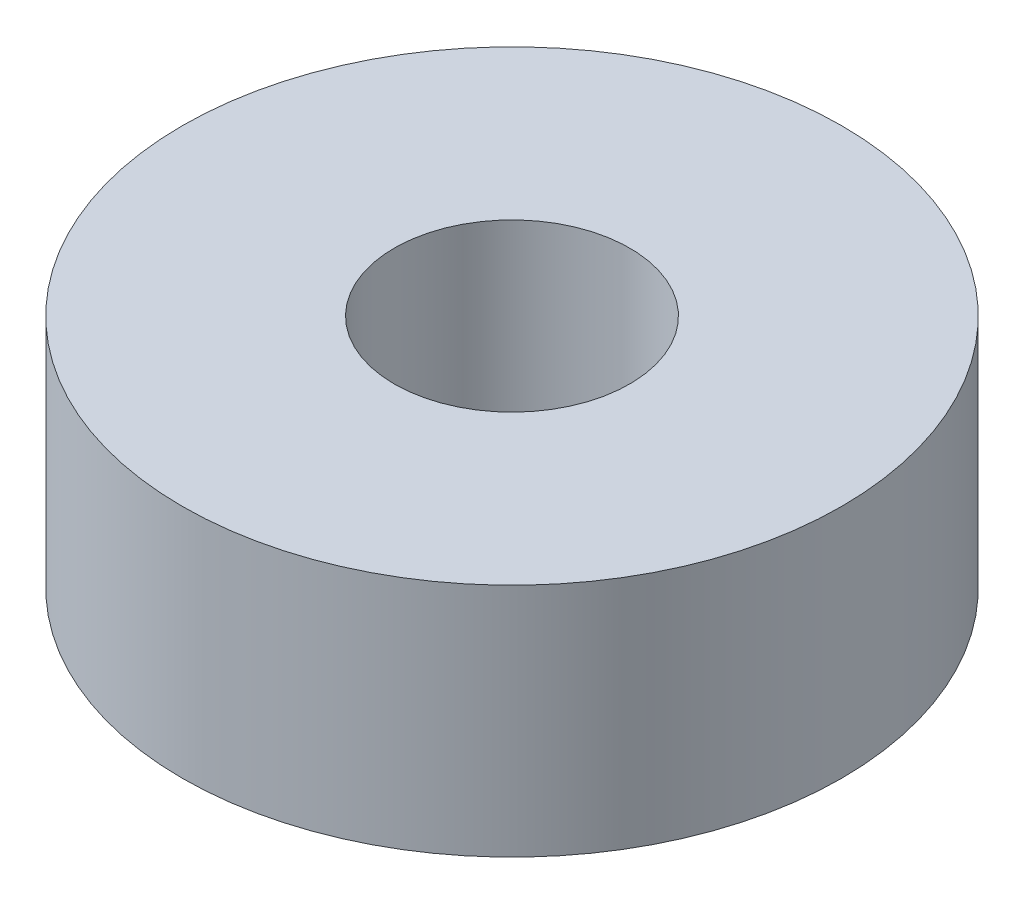
from build123d import *

# Parameters (mm, degrees)
SKETCH1_R           = 7
SKETCH1_R_2         = 2.5
BOSS_EXTRUDE1_DEPTH = 2.5


with BuildPart() as part:
    # Sketch1 → Boss-Extrude1 (new, symmetric)
    with BuildSketch(Plane(origin=(0, 0, 0), x_dir=(1, 0, 0), z_dir=(0, 1, 0))):
        Circle(SKETCH1_R)
        Circle(SKETCH1_R_2, mode=Mode.SUBTRACT)
    extrude(amount=BOSS_EXTRUDE1_DEPTH, both=True)


solid = part.part
